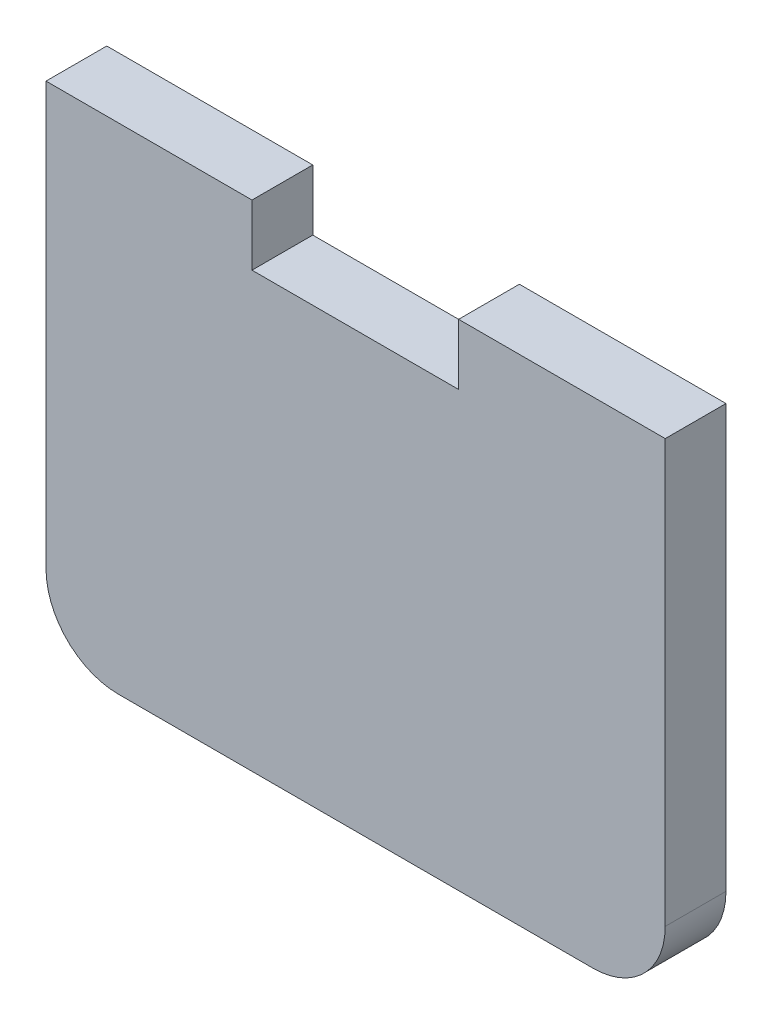
from build123d import *

# Parameters (mm, degrees)
SKETCH1_W           = 54.356
SKETCH1_H           = 43.434
BOSS_EXTRUDE1_DEPTH = 5.334
SKETCH2_W           = 18.137033298
SKETCH2_H           = 5.334
CUT_EXTRUDE1_DEPTH  = 41.016719041
FILLET1_R           = 6.35


with BuildPart() as part:
    # Sketch1 → Boss-Extrude1 (new body)
    with BuildSketch(Plane.XY):
        with Locations((-3.35450847, 3.594107707)):
            Rectangle(SKETCH1_W, SKETCH1_H)
    extrude(amount=BOSS_EXTRUDE1_DEPTH)

    # Sketch2 → Cut-Extrude1 (cut, through all)
    with BuildSketch(Plane.XY.offset(5.334)):
        with Locations((-3.382058417, 22.644107707)):
            Rectangle(SKETCH2_W, SKETCH2_H)
    extrude(amount=-CUT_EXTRUDE1_DEPTH, mode=Mode.SUBTRACT)

    # Fillet1
    fillet1_edges = [part.edges().sort_by_distance(p)[0] for p in [
        (-30.53250847, -18.122892293, 2.667),
        (23.82349153, -18.122892293, 2.667),
    ]]
    fillet(fillet1_edges, radius=FILLET1_R)


solid = part.part
